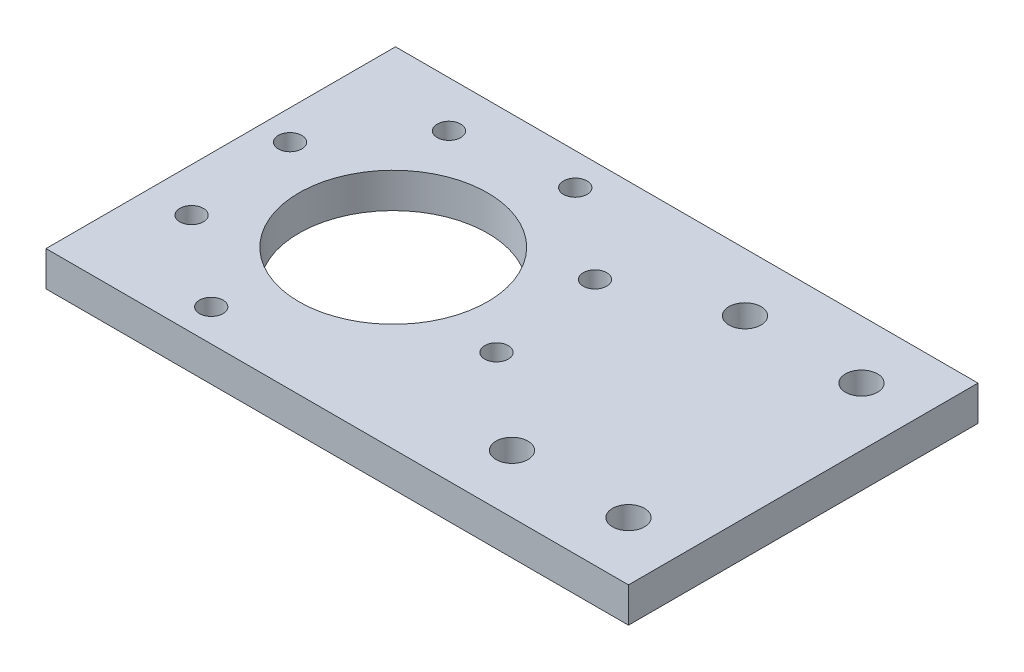
from build123d import *

# Parameters (mm, degrees)
SKETCH1_W           = 100
SKETCH1_H           = 60
BOSS_EXTRUDE1_DEPTH = 6
SKETCH2_R           = 16.19728467
SKETCH2_R_2         = 2.75
CUT_EXTRUDE1_DEPTH  = 6
SKETCH3_R           = 2.0193
CUT_EXTRUDE2_DEPTH  = 6


with BuildPart() as part:
    # Sketch1 → Boss-Extrude1 (new body)
    with BuildSketch(Plane(origin=(0, 0, 0), x_dir=(1, 0, 0), z_dir=(0, 1, 0))):
        with Locations((50, 30)):
            Rectangle(SKETCH1_W, SKETCH1_H)
    extrude(amount=BOSS_EXTRUDE1_DEPTH)

    # Sketch2 → Cut-Extrude1 (cut)
    with BuildSketch(Plane(origin=(0, 6, 0), x_dir=(1, 0, 0), z_dir=(0, 1, 0))):
        with Locations((29.615341175, 30)):
            Circle(SKETCH2_R)
        with Locations((70, 50)):
            Circle(SKETCH2_R_2)
        with Locations((90, 50)):
            Circle(SKETCH2_R_2)
        with Locations((70, 10)):
            Circle(SKETCH2_R_2)
        with Locations((90, 10)):
            Circle(SKETCH2_R_2)
    extrude(amount=-CUT_EXTRUDE1_DEPTH, mode=Mode.SUBTRACT)

    # Sketch3 → Cut-Extrude2 (cut)
    with BuildSketch(Plane.XZ):
        with Locations((54.098316704, -23.236575625)):
            Circle(SKETCH3_R)
        with Locations((51.709882435, -42.52961478)):
            Circle(SKETCH3_R)
        with Locations((36.378765551, -54.482975528)):
            Circle(SKETCH3_R)
        with Locations((17.085726396, -52.09454126)):
            Circle(SKETCH3_R)
        with Locations((7.520799916, -17.47038522)):
            Circle(SKETCH3_R)
        with Locations((22.8519168, -5.517024472)):
            Circle(SKETCH3_R)
        with Locations((5.132365647, -36.763424375)):
            Circle(SKETCH3_R)
    extrude(amount=-CUT_EXTRUDE2_DEPTH, mode=Mode.SUBTRACT)


solid = part.part
